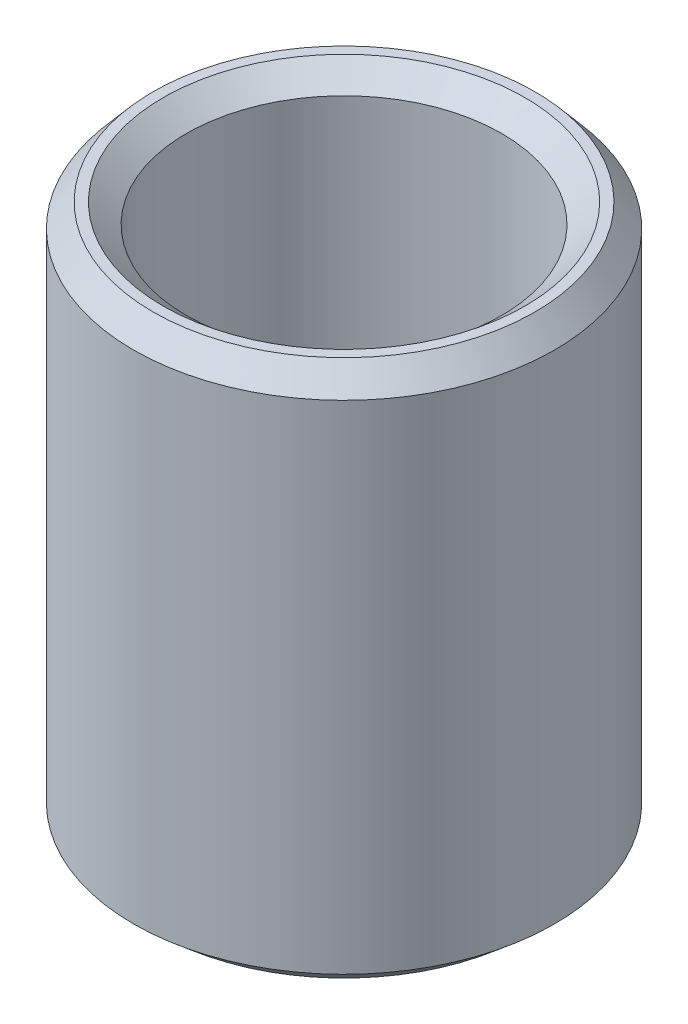
from build123d import *
from OCP.BRepFilletAPI import BRepFilletAPI_MakeChamfer

# Parameters (mm, degrees)
SKETCH1_R           = 10
BOSS_EXTRUDE1_DEPTH = 25.644402832
SKETCH2_R           = 7.490570047
CUT_EXTRUDE1_DEPTH  = 30.285412693
CHAMFER1_SIZE       = 1.096916684
CHAMFER1_SIZE2      = 0.931687125


with BuildPart() as part:
    # Sketch1 → Boss-Extrude1 (new body)
    with BuildSketch(Plane(origin=(0, 0, 0), x_dir=(1, 0, 0), z_dir=(0, 1, 0))):
        Circle(SKETCH1_R)
    extrude(amount=BOSS_EXTRUDE1_DEPTH)

    # Sketch2 → Cut-Extrude1 (cut, through all)
    with BuildSketch(Plane(origin=(0, 0, 0), x_dir=(1, 0, 0), z_dir=(0, 1, 0))):
        Circle(SKETCH2_R)
    extrude(amount=CUT_EXTRUDE1_DEPTH, mode=Mode.SUBTRACT)

    # Chamfer1: one chamfer whose edges measure the first distance from different faces: ONE call of the kernel's chamfer builder (chamfer() names one face for all edges)
    chamfer1_edges_1 = [part.edges().sort_by_distance(p)[0] for p in [
        (-7.490570047, 25.644402832, 0),
    ]]
    chamfer1_side_1 = [part.faces().sort_by_distance(p)[0] for p in [
        (-9.717157288, 25.644402832, 0),
    ]]
    chamfer1_edges_2 = [part.edges().sort_by_distance(p)[0] for p in [
        (-7.490570047, 0, 0),
    ]]
    chamfer1_side_2 = [part.faces().sort_by_distance(p)[0] for p in [
        (-7.490570047, 12.822201416, 0),
    ]]
    chamfer1_edges_3 = [part.edges().sort_by_distance(p)[0] for p in [
        (-10, 0, 0),
    ]]
    chamfer1_side_3 = [part.faces().sort_by_distance(p)[0] for p in [
        (-9.717157288, 0, 0),
    ]]
    chamfer1_edges_4 = [part.edges().sort_by_distance(p)[0] for p in [
        (-10, 25.644402832, 0),
    ]]
    chamfer1_side_4 = [part.faces().sort_by_distance(p)[0] for p in [
        (-10, 12.822201416, 0),
    ]]
    chamfer1 = BRepFilletAPI_MakeChamfer(part.part.solid().wrapped)
    for e in chamfer1_edges_1:
        chamfer1.Add(CHAMFER1_SIZE, CHAMFER1_SIZE2, e.wrapped, chamfer1_side_1[0].wrapped)  # the first distance lies on this face
    for e in chamfer1_edges_2:
        chamfer1.Add(CHAMFER1_SIZE, CHAMFER1_SIZE2, e.wrapped, chamfer1_side_2[0].wrapped)  # the first distance lies on this face
    for e in chamfer1_edges_3:
        chamfer1.Add(CHAMFER1_SIZE, CHAMFER1_SIZE2, e.wrapped, chamfer1_side_3[0].wrapped)  # the first distance lies on this face
    for e in chamfer1_edges_4:
        chamfer1.Add(CHAMFER1_SIZE, CHAMFER1_SIZE2, e.wrapped, chamfer1_side_4[0].wrapped)  # the first distance lies on this face
    add(Compound.cast(chamfer1.Shape()), mode=Mode.REPLACE)


solid = part.part
